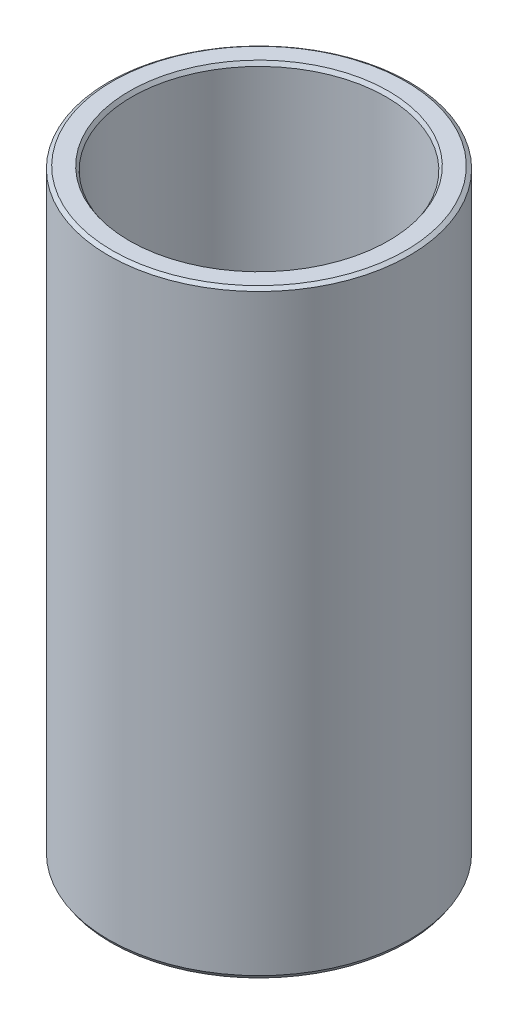
from build123d import *
from OCP.BRepFilletAPI import BRepFilletAPI_MakeChamfer

# Parameters (mm, degrees)
SKETCH1_R           = 60
BOSS_EXTRUDE1_DEPTH = 238.885693285
SKETCH2_R           = 50.75341379
CUT_EXTRUDE1_DEPTH  = 254.508134891
CHAMFER1_SIZE       = 0.978529867
CHAMFER1_SIZE2      = 1.497156359


with BuildPart() as part:
    # Sketch1 → Boss-Extrude1 (new body)
    with BuildSketch(Plane(origin=(0, 0, 0), x_dir=(1, 0, 0), z_dir=(0, 1, 0))):
        Circle(SKETCH1_R)
    extrude(amount=BOSS_EXTRUDE1_DEPTH)

    # Sketch2 → Cut-Extrude1 (cut, through all)
    with BuildSketch(Plane(origin=(0, 0, 0), x_dir=(1, 0, 0), z_dir=(0, 1, 0))):
        Circle(SKETCH2_R)
    extrude(amount=CUT_EXTRUDE1_DEPTH, mode=Mode.SUBTRACT)

    # Chamfer1: one chamfer whose edges measure the first distance from different faces: ONE call of the kernel's chamfer builder (chamfer() names one face for all edges)
    chamfer1_edges_1 = [part.edges().sort_by_distance(p)[0] for p in [
        (-50.75341379, 238.885693285, 0),
    ]]
    chamfer1_side_1 = [part.faces().sort_by_distance(p)[0] for p in [
        (-58.302943725, 238.885693285, 0),
    ]]
    chamfer1_edges_2 = [part.edges().sort_by_distance(p)[0] for p in [
        (-50.75341379, 0, 0),
    ]]
    chamfer1_side_2 = [part.faces().sort_by_distance(p)[0] for p in [
        (-50.75341379, 119.442846642, 0),
    ]]
    chamfer1_edges_3 = [part.edges().sort_by_distance(p)[0] for p in [
        (-60, 0, 0),
    ]]
    chamfer1_side_3 = [part.faces().sort_by_distance(p)[0] for p in [
        (-58.302943725, 0, 0),
    ]]
    chamfer1_edges_4 = [part.edges().sort_by_distance(p)[0] for p in [
        (-60, 238.885693285, 0),
    ]]
    chamfer1_side_4 = [part.faces().sort_by_distance(p)[0] for p in [
        (-60, 119.442846642, 0),
    ]]
    chamfer1 = BRepFilletAPI_MakeChamfer(part.part.solid().wrapped)
    for e in chamfer1_edges_1:
        chamfer1.Add(CHAMFER1_SIZE, CHAMFER1_SIZE2, e.wrapped, chamfer1_side_1[0].wrapped)  # the first distance lies on this face
    for e in chamfer1_edges_2:
        chamfer1.Add(CHAMFER1_SIZE, CHAMFER1_SIZE2, e.wrapped, chamfer1_side_2[0].wrapped)  # the first distance lies on this face
    for e in chamfer1_edges_3:
        chamfer1.Add(CHAMFER1_SIZE, CHAMFER1_SIZE2, e.wrapped, chamfer1_side_3[0].wrapped)  # the first distance lies on this face
    for e in chamfer1_edges_4:
        chamfer1.Add(CHAMFER1_SIZE, CHAMFER1_SIZE2, e.wrapped, chamfer1_side_4[0].wrapped)  # the first distance lies on this face
    add(Compound.cast(chamfer1.Shape()), mode=Mode.REPLACE)


solid = part.part
